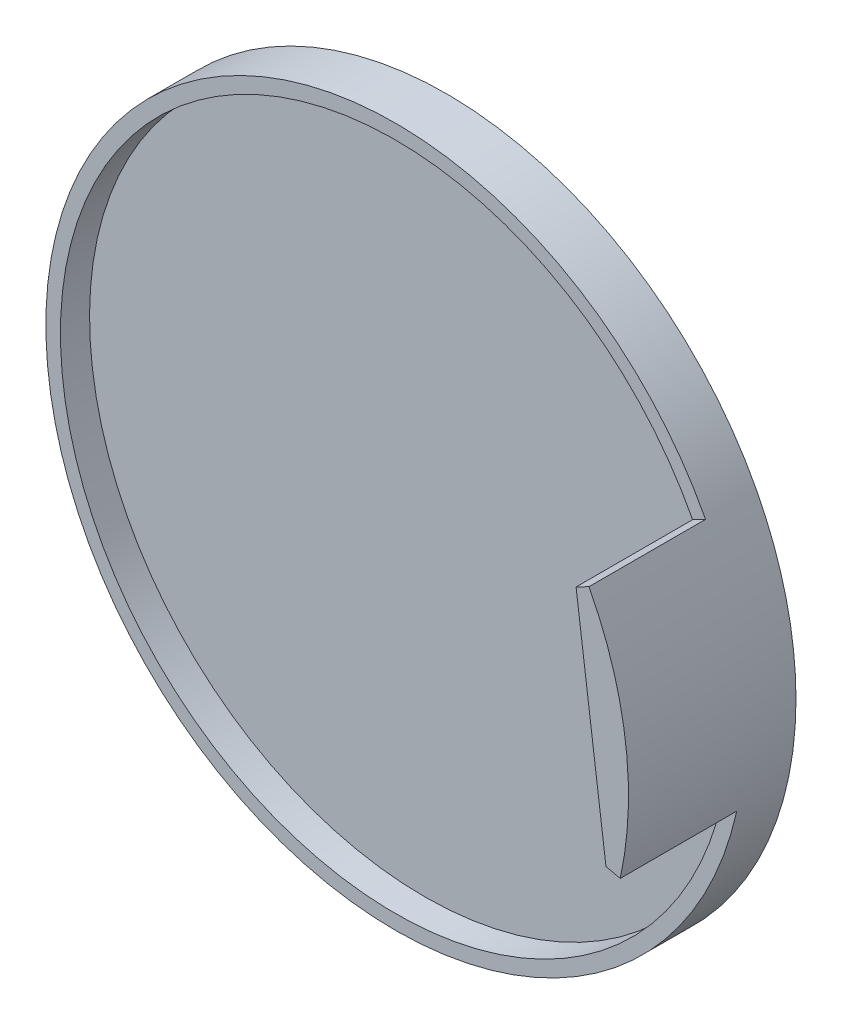
from build123d import *

# Parameters (mm, degrees)
SKETCH1_R           = 48
BOSS_EXTRUDE1_DEPTH = 3
SKETCH2_R           = 48
SKETCH2_R_2         = 46
BOSS_EXTRUDE2_DEPTH = 4
BOSS_EXTRUDE3_DEPTH = 20
FILLET1_R           = 2


with BuildPart() as part:
    # Sketch1 → Boss-Extrude1 (new body)
    with BuildSketch(Plane(origin=(0, 0, 0), x_dir=(0, 1, 0), z_dir=(0, 0, 1))):
        Circle(SKETCH1_R)
    extrude(amount=BOSS_EXTRUDE1_DEPTH)

    # Sketch2 → Boss-Extrude2 (add)
    with BuildSketch(Plane.XY.offset(3)):
        Circle(SKETCH2_R)
        Circle(SKETCH2_R_2, mode=Mode.SUBTRACT)
    extrude(amount=BOSS_EXTRUDE2_DEPTH)

    # Sketch3 → Boss-Extrude3 (add)
    with BuildSketch(Plane.XY.offset(3)):
        with BuildLine():
            Line((42.576897618, 22.163208008), (40.802860217, 21.239741008))
            Line((40.802860217, 21.239741008), (44.909446686, -9.956987415))
            Line((44.909446686, -9.956987415), (46.862031324, -10.389899911))
            ThreePointArc((46.862031324, -10.389899911), (47.589460087, 6.264446393), (42.576897618, 22.163208008))
        make_face()
    extrude(amount=BOSS_EXTRUDE3_DEPTH)

    # Fillet1
    fillet1_edges = [part.edges().sort_by_distance(p)[0] for p in [
        (42.856153452, 5.641376796, 3),
    ]]
    fillet(fillet1_edges, radius=FILLET1_R)


solid = part.part
